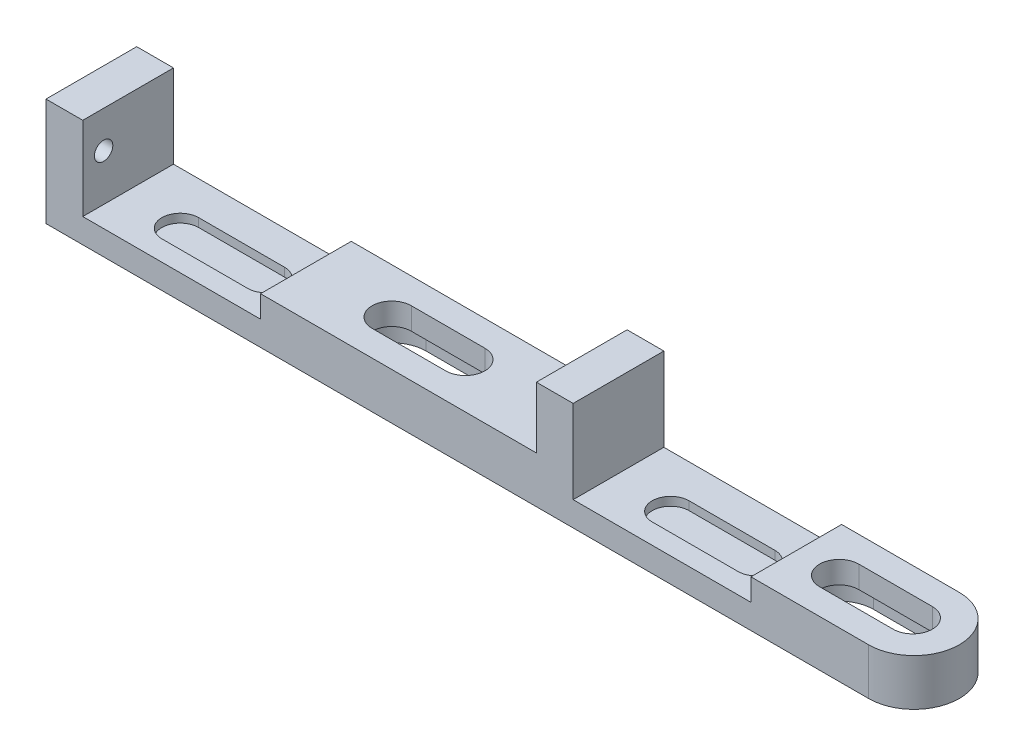
from build123d import *

# Parameters (mm, degrees)
BOSS_EXTRUDE1_DEPTH = 7.4
CUT_EXTRUDE1_DEPTH  = 10
CUT_EXTRUDE2_START  = -2
CUT_EXTRUDE2_DEPTH  = 2
CUT_EXTRUDE3_REACH  = 73.728
SKETCH5_R           = 0.75
CUT_EXTRUDE4_DEPTH  = 10
CUT_EXTRUDE6_DEPTH  = 0.7


with BuildPart() as part:
    # Sketch1 → Boss-Extrude1 (new body)
    with BuildSketch(Plane.XY):
        Polygon((0, 0), (0, 8.8), (3, 8.8), (3, 2), (17.5, 2), (17.5, 3.8), (40, 3.8), (40, 8.8), (43, 8.8), (43, 2), (57.5, 2), (57.5, 3.8), (70.8, 3.8), (70.8, 0), align=None)
    extrude(amount=BOSS_EXTRUDE1_DEPTH)

    # Sketch3 → Cut-Extrude1 (cut)
    with BuildSketch(Plane(origin=(0, 3.8, 0), x_dir=(1, 0, 0), z_dir=(0, 1, 0))):
        with BuildLine():
            Line((30.5, -5.3), (24.5, -5.3))
            ThreePointArc((24.5, -5.3), (22.9, -3.7), (24.5, -2.1))
            Line((24.5, -2.1), (30.5, -2.1))
            ThreePointArc((30.5, -2.1), (32.1, -3.7), (30.5, -5.3))
        make_face()
        with BuildLine():
            Line((67, -5.3), (61, -5.3))
            ThreePointArc((61, -5.3), (59.4, -3.7), (61, -2.1))
            Line((61, -2.1), (67, -2.1))
            ThreePointArc((67, -2.1), (68.6, -3.7), (67, -5.3))
        make_face()
    extrude(amount=-CUT_EXTRUDE1_DEPTH, mode=Mode.SUBTRACT)

    # Sketch4 → Cut-Extrude2 (cut)
    # profile 1 of 2: a face of its own
    with BuildSketch(Plane.XZ.offset(CUT_EXTRUDE2_START)):
        with BuildLine():
            Line((24.5, 6.5), (30.5, 6.5))
            ThreePointArc((30.5, 6.5), (33.3, 3.7), (30.5, 0.9))
            Line((30.5, 0.9), (24.5, 0.9))
            ThreePointArc((24.5, 0.9), (21.7, 3.7), (24.5, 6.5))
        make_face()
        with BuildLine():
            Line((24.5, 5.3), (30.5, 5.3))
            ThreePointArc((30.5, 5.3), (32.1, 3.7), (30.5, 2.1))
            Line((30.5, 2.1), (24.5, 2.1))
            ThreePointArc((24.5, 2.1), (22.9, 3.7), (24.5, 5.3))
        make_face(mode=Mode.SUBTRACT)
    # profile 2 of 2: a face of its own
    with BuildSketch(Plane.XZ.offset(CUT_EXTRUDE2_START)):
        with BuildLine():
            Line((61, 6.5), (67, 6.5))
            ThreePointArc((67, 6.5), (69.8, 3.7), (67, 0.9))
            Line((67, 0.9), (61, 0.9))
            ThreePointArc((61, 0.9), (58.2, 3.7), (61, 6.5))
        make_face()
        with BuildLine():
            Line((61, 5.3), (67, 5.3))
            ThreePointArc((67, 5.3), (68.6, 3.7), (67, 2.1))
            Line((67, 2.1), (61, 2.1))
            ThreePointArc((61, 2.1), (59.4, 3.7), (61, 5.3))
        make_face(mode=Mode.SUBTRACT)
    extrude(amount=CUT_EXTRUDE2_DEPTH, mode=Mode.SUBTRACT)

    # Sketch5 → Cut-Extrude3 (cut, up to next)
    with BuildSketch(Plane.ZY, mode=Mode.PRIVATE) as cut_extrude3_sk1:
        with Locations((5.7, 5.8)):
            Circle(SKETCH5_R)
    cut_extrude3_tool1 = extrude(cut_extrude3_sk1.sketch, amount=-CUT_EXTRUDE3_REACH, mode=Mode.PRIVATE) & part.part
    add(cut_extrude3_tool1.solids().sort_by_distance((0, 5.8, 5.7))[0], mode=Mode.SUBTRACT)

    # Sketch6 → Cut-Extrude4 (cut)
    with BuildSketch(Plane.XZ):
        with BuildLine():
            Line((67.1, 0), (70.8, 0))
            Line((70.8, 0), (70.8, 3.7))
            ThreePointArc((70.8, 3.7), (69.71629509, 1.08370491), (67.1, 0))
        make_face()
        with BuildLine():
            ThreePointArc((67.1, 7.4), (69.71629509, 6.31629509), (70.8, 3.7))
            Line((70.8, 3.7), (70.8, 7.4))
            Line((70.8, 7.4), (67.1, 7.4))
        make_face()
    extrude(amount=-CUT_EXTRUDE4_DEPTH, mode=Mode.SUBTRACT)

    # Sketch8 → Cut-Extrude6 (cut)
    with BuildSketch(Plane(origin=(0, 2, 0), x_dir=(1, 0, 0), z_dir=(0, 1, 0))):
        with BuildLine():
            Line((7.8, -2.75), (14.8, -2.75))
            ThreePointArc((14.8, -2.75), (16.3, -4.25), (14.8, -5.75))
            Line((14.8, -5.75), (7.8, -5.75))
            ThreePointArc((7.8, -5.75), (6.3, -4.25), (7.8, -2.75))
        make_face()
        with BuildLine():
            Line((47.8, -2.75), (54.8, -2.75))
            ThreePointArc((54.8, -2.75), (56.3, -4.25), (54.8, -5.75))
            Line((54.8, -5.75), (47.8, -5.75))
            ThreePointArc((47.8, -5.75), (46.3, -4.25), (47.8, -2.75))
        make_face()
    extrude(amount=-CUT_EXTRUDE6_DEPTH, mode=Mode.SUBTRACT)


solid = part.part
